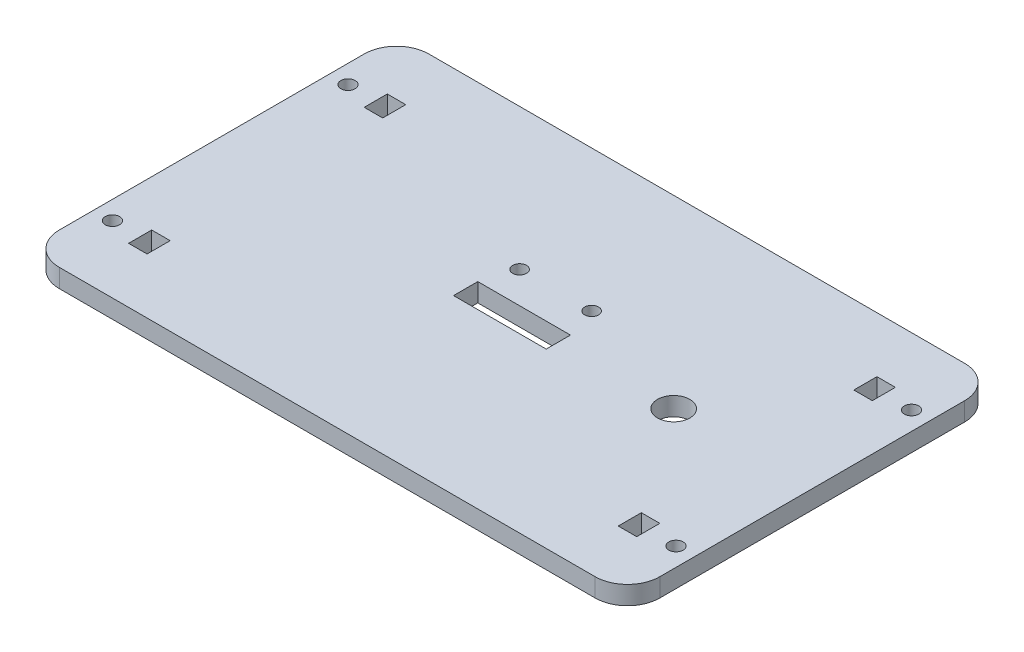
from build123d import *

# Parameters (mm, degrees)
SKETCH1_R           = 1.55
SKETCH1_R_2         = 3.5
SKETCH1_R_3         = 1.5
SKETCH1_W           = 4
SKETCH1_H           = 5
SKETCH1_W_2         = 20.06
SKETCH1_H_2         = 5.25
BOSS_EXTRUDE1_DEPTH = 4


with BuildPart() as part:
    # Sketch1 → Boss-Extrude1 (new body)
    with BuildSketch(Plane(origin=(0, 0, 0), x_dir=(1, 0, 0), z_dir=(0, 1, 0))):
        with BuildLine():
            Line((-58, -40), (58, -40))
            ThreePointArc((58, -40), (62.949747468, -37.949747468), (65, -33))
            Line((65, -33), (65, 33))
            ThreePointArc((65, 33), (62.949747468, 37.949747468), (58, 40))
            Line((58, 40), (-58, 40))
            ThreePointArc((-58, 40), (-62.949747468, 37.949747468), (-65, 33))
            Line((-65, 33), (-65, -33))
            ThreePointArc((-65, -33), (-62.949747468, -37.949747468), (-58, -40))
        make_face()
        with Locations((61, 25.5)):
            Circle(SKETCH1_R, mode=Mode.SUBTRACT)
        with Locations((61, -25.5)):
            Circle(SKETCH1_R, mode=Mode.SUBTRACT)
        with Locations((-61, -25.5)):
            Circle(SKETCH1_R, mode=Mode.SUBTRACT)
        with Locations((-61, 25.5)):
            Circle(SKETCH1_R, mode=Mode.SUBTRACT)
        with Locations((35, 0)):
            Circle(SKETCH1_R_2, mode=Mode.SUBTRACT)
        with Locations((-7.8, 9.445)):
            Circle(SKETCH1_R_3, mode=Mode.SUBTRACT)
        with Locations((7.8, 9.445)):
            Circle(SKETCH1_R_3, mode=Mode.SUBTRACT)
        with Locations((53, -25.5)):
            Rectangle(SKETCH1_W, SKETCH1_H, mode=Mode.SUBTRACT)
        with Locations((53, 25.5)):
            Rectangle(SKETCH1_W, SKETCH1_H, mode=Mode.SUBTRACT)
        with Locations((-53, 25.5)):
            Rectangle(SKETCH1_W, SKETCH1_H, mode=Mode.SUBTRACT)
        with Locations((-53, -25.5)):
            Rectangle(SKETCH1_W, SKETCH1_H, mode=Mode.SUBTRACT)
        Rectangle(SKETCH1_W_2, SKETCH1_H_2, mode=Mode.SUBTRACT)
    extrude(amount=BOSS_EXTRUDE1_DEPTH)


solid = part.part
